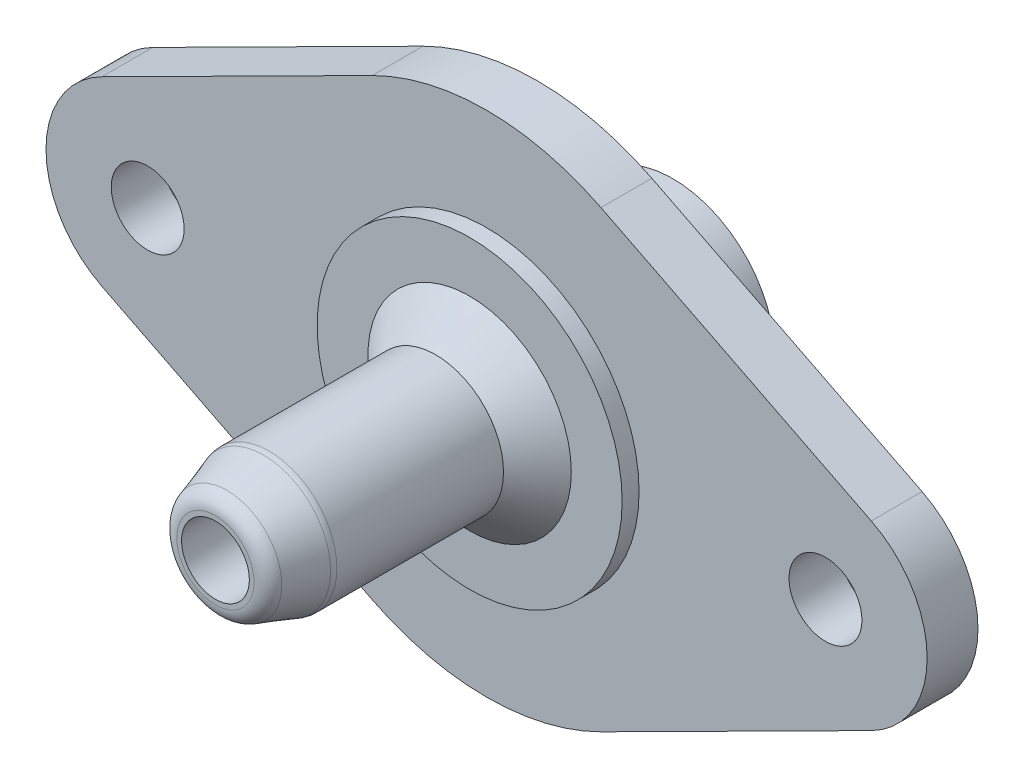
from build123d import *

# Parameters (mm, degrees)
SKETCH_1_R      = 6
SKETCH_1_R_2    = 3
EXTRUDE_1_DEPTH = 8
SKETCH_2_R      = 9
SKETCH_2_R_2    = 3
EXTRUDE_2_DEPTH = 4
SKETCH_3_R      = 4
SKETCH_3_R_2    = 2
EXTRUDE_3_DEPTH = 15
CHAMFER_1_SIZE  = 2
CHAMFER_2_SIZE  = 3
CHAMFER_2_SIZE2 = 1
FILLET_1_R      = 1
SKETCH_4_R      = 9
SKETCH_4_R_2    = 2.15
EXTRUDE_5_DEPTH = 3


with BuildPart() as part:
    # 草图1 → 凸台-拉伸1 (new body)
    with BuildSketch(Plane.XY):
        Circle(SKETCH_1_R)
        Circle(SKETCH_1_R_2, mode=Mode.SUBTRACT)
    extrude(amount=EXTRUDE_1_DEPTH)

    # 草图2 → 凸台-拉伸2 (add)
    with BuildSketch(Plane.XY.offset(8)):
        Circle(SKETCH_2_R)
        Circle(SKETCH_2_R_2, mode=Mode.SUBTRACT)
    extrude(amount=EXTRUDE_2_DEPTH)

    # 草图3 → 凸台-拉伸3 (add)
    with BuildSketch(Plane.XY.offset(12)):
        Circle(SKETCH_3_R)
        Circle(SKETCH_3_R_2, mode=Mode.SUBTRACT)
    extrude(amount=EXTRUDE_3_DEPTH)

    # 倒角1
    # the kernel refuses this chamfer: 2 mm, written as the material it adds along each edge
    with BuildSketch(Plane(origin=(0, 0, 12), x_dir=(1, 0, 0), z_dir=(0, -1, 0))) as chamfer_1_piece_1:
        Polygon((4 + CHAMFER_1_SIZE, 0), (4, CHAMFER_1_SIZE), (4, 0), align=None)
    revolve(axis=Axis((0, 0, 12), (0, 0, 1)))
    # the kernel refuses this chamfer: 2 mm, written as the material it takes off along each edge
    with BuildSketch(Plane(origin=(0, 0, 12), x_dir=(1, 0, 0), z_dir=(0, -1, 0))) as chamfer_1_2_piece_1_section:
        Polygon((2 + CHAMFER_1_SIZE, 0), (2, CHAMFER_1_SIZE), (2, 0), align=None)
    chamfer_1_2_piece_1 = revolve(axis=Axis((0, 0, 12), (0, 0, 1)), mode=Mode.PRIVATE)
    chamfer_1_2_piece_1 = chamfer_1_2_piece_1 & Plane(origin=(0, 0, 13.507652587), x_dir=(1, 0, 0), z_dir=(0, 0, -1)) * Cylinder(3, 16, mode=Mode.PRIVATE)
    add(chamfer_1_2_piece_1, mode=Mode.SUBTRACT)

    # 倒角2
    chamfer_2_edges = [part.edges().sort_by_distance(p)[0] for p in [
        (-4, 0, 27),
    ]]
    chamfer_2_side = [part.faces().sort_by_distance(p)[0] for p in [
        (-4, 0, 20.5),
    ]]
    chamfer(chamfer_2_edges, length=CHAMFER_2_SIZE, length2=CHAMFER_2_SIZE2, reference=chamfer_2_side[0])

    # 圆角1
    fillet_1_edges = [part.edges().sort_by_distance(p)[0] for p in [
        (-3, 0, 27),
        (-4, 0, 24),
    ]]
    fillet(fillet_1_edges, radius=FILLET_1_R)

    # 草图4 → 凸台-拉伸5 (add)
    with BuildSketch(Plane.XY.offset(8)):
        with BuildLine():
            Line((-22.7, 5.35817133), (-6.75, 13.395428325))
            ThreePointArc((-6.75, 13.395428325), (0, 15), (6.75, 13.395428325))
            Line((6.75, 13.395428325), (22.7, 5.35817133))
            ThreePointArc((22.7, 5.35817133), (26, 0), (22.7, -5.35817133))
            Line((22.7, -5.35817133), (6.75, -13.395428325))
            ThreePointArc((6.75, -13.395428325), (0, -15), (-6.75, -13.395428325))
            Line((-6.75, -13.395428325), (-22.7, -5.35817133))
            ThreePointArc((-22.7, -5.35817133), (-26, 0), (-22.7, 5.35817133))
        make_face()
        Circle(SKETCH_4_R, mode=Mode.SUBTRACT)
        with Locations((20, 0)):
            Circle(SKETCH_4_R_2, mode=Mode.SUBTRACT)
        with Locations((-20, 0)):
            Circle(SKETCH_4_R_2, mode=Mode.SUBTRACT)
    extrude(amount=EXTRUDE_5_DEPTH)


solid = part.part
